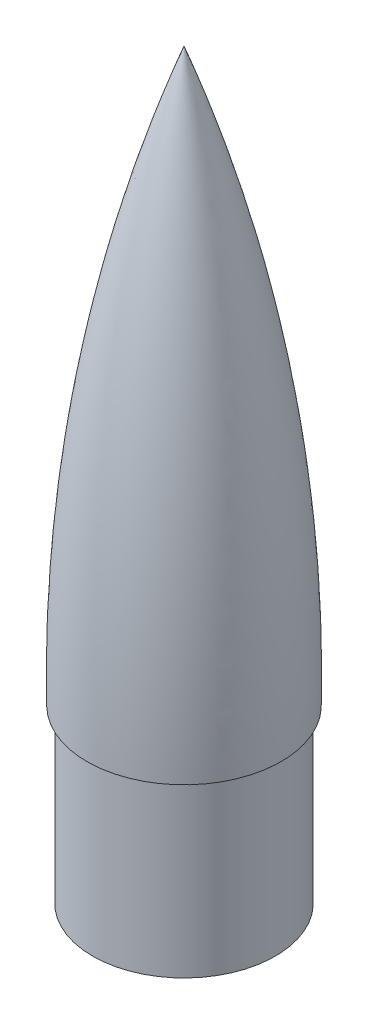
from build123d import *

# Parameters (mm, degrees)
SKETCH_1_R          = 16
SKETCH_1_R_2        = 15
EXTRUDE_1_DEPTH     = 30
SKETCH_7_R          = 0.8
CUT_EXTRUDE_1_DEPTH = 133.215078272


with BuildPart() as part:
    # Эскиз1 → Бобышка-Вытянуть1 (new body)
    with BuildSketch(Plane(origin=(0, 0, 0), x_dir=(1, 0, 0), z_dir=(0, 1, 0))):
        Circle(SKETCH_1_R)
        Circle(SKETCH_1_R_2, mode=Mode.SUBTRACT)
    extrude(amount=EXTRUDE_1_DEPTH)

    # Эскиз5 → Повернуть1 (revolve)
    with BuildSketch(Plane.XY):
        with BuildLine():
            Line((0, 30), (0, 130))
            ThreePointArc((0, 130), (-13.157936889, 80.791849271), (-17, 30))
            Line((-17, 30), (0, 30))
        make_face()
    revolve(axis=Axis((0, 100, 0), (0, -1, 0)))

    # Эскиз6 → Вырез-Повернуть1 (revolve, cut)
    with BuildSketch(Plane.XY):
        with BuildLine():
            Line((0, 127.5), (0, 30))
            Line((0, 30), (-15, 30))
            add(Edge.make_bspline(
                [(-14.45363087, 41.68986818), (-14.564513424, 36.70975996), (-15, 30)],
                knots=[0, 0, 0, 1, 1, 1], degree=2))
            ThreePointArc((-14.45363087, 41.68986818), (-11.842254072, 73.004469438), (-5.637607077, 103.809110264))
            add(Edge.make_bspline(
                [(0, 127.5), (-1.285260326, 123.677634701), (-2.143778885, 120.771879578), (-5.637607077, 103.809110264)],
                knots=[0, 0, 0, 0, 1, 1, 1, 1], degree=3))
        make_face()
    revolve(axis=Axis((0, 127.5, 0), (0, -1, 0)), mode=Mode.SUBTRACT)

    # Эскиз7 → Вырез-Вытянуть1 (cut, through all)
    with BuildSketch(Plane.XY):
        with Locations((0, 2.5)):
            Circle(SKETCH_7_R)
    extrude(amount=-CUT_EXTRUDE_1_DEPTH, mode=Mode.SUBTRACT)


solid = part.part
